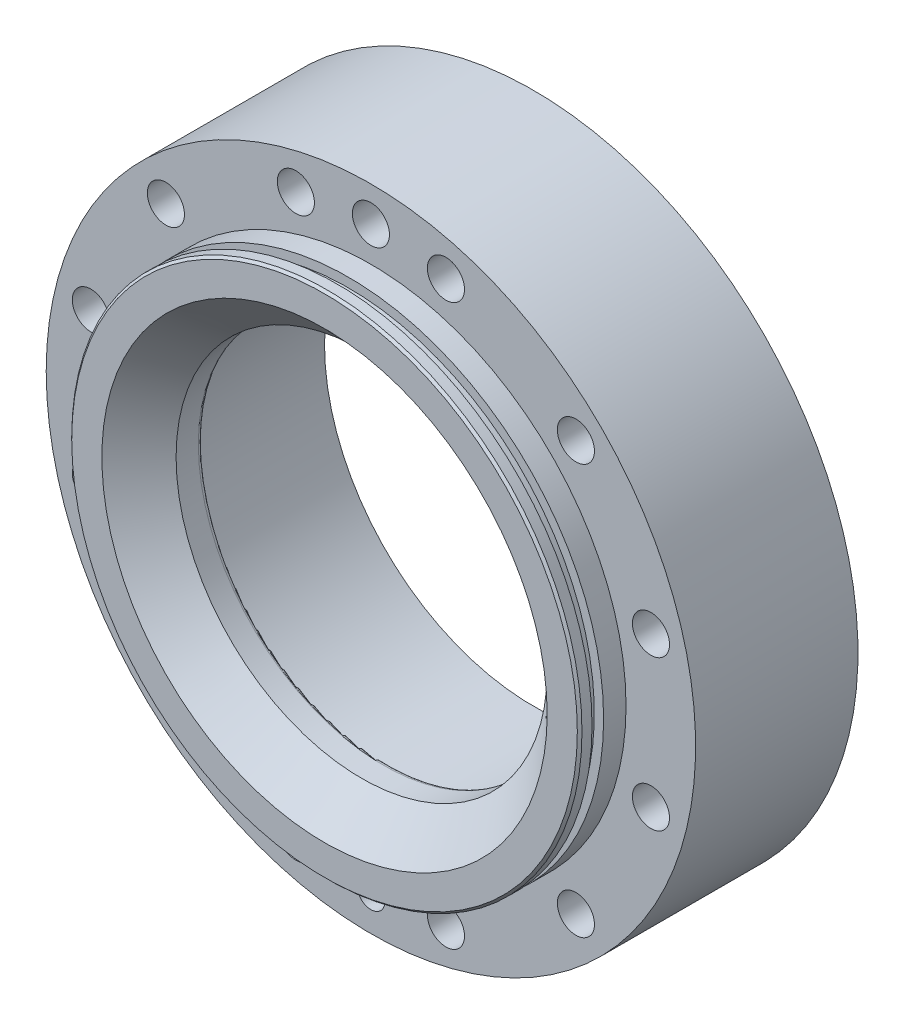
from build123d import *

# Parameters (mm, degrees)
SKETCH2_R             = 3
CUT_EXTRUDE1_DEPTH    = 9
SKETCH3_R             = 4
CUT_EXTRUDE2_DEPTH    = 10
SKETCH9_W             = 2
SKETCH9_H             = 2.5
CHAMFER1_SIZE         = 0.5
F_8_0MM_DOWEL_HOLE1_D = 8
FILLET2_R             = 1
CHAMFER2_SIZE         = 8


with BuildPart() as part:
    # Sketch1 → Revolve1 (revolve)
    with BuildSketch(Plane(origin=(0, 0, 0), x_dir=(1, 0, 0), z_dir=(0, 1, 0))):
        Polygon((-55, -19.79575879), (-55, -9.79575879), (-70, -9.79575879), (-70, 25.20424121), (-45, 25.20424121), (-45, -6), (-40, -6), (-40, -19.79575879), align=None)
    revolve(axis=Axis((0, 0, -52.707374268), (0, 0, 1)))

    # Sketch2 → Cut-Extrude1 (cut)
    with BuildSketch(Plane.XY.offset(9.79575879)):
        with Locations((0, -62.5)):
            Circle(SKETCH2_R)
    extrude(amount=-CUT_EXTRUDE1_DEPTH, mode=Mode.SUBTRACT)

    # Sketch3 → Cut-Extrude2 (cut)
    with BuildSketch(Plane.XY.offset(9.79575879)):
        with Locations((0, 62.5)):
            Circle(SKETCH3_R)
    extrude(amount=-CUT_EXTRUDE2_DEPTH, mode=Mode.SUBTRACT)

    # Sketch9 → Oring groove (revolve, cut)
    with BuildSketch(Plane(origin=(0, 0, 0), x_dir=(1, 0, 0), z_dir=(0, 1, 0))):
        with Locations((-54, -15.877787378)):
            Rectangle(SKETCH9_W, SKETCH9_H)
    revolve(axis=Axis((0, 0, -11.30771881), (0, 0, 1)), mode=Mode.SUBTRACT)

    # Chamfer1
    chamfer1_edges = [part.edges().sort_by_distance(p)[0] for p in [
        (55, 0, 19.79575879),
    ]]
    chamfer(chamfer1_edges, length=CHAMFER1_SIZE)

    # Ø8.0mm Dowel Hole1 (through all)
    with Locations(Plane.XY.offset(9.79575879)):
        with Locations((-60.370364143, 16.176190319), (-44.194173824, 44.194173824), (-16.176190319, 60.370364143), (16.176190319, 60.370364143), (44.194173824, 44.194173824), (60.370364143, 16.176190319), (60.370364143, -16.176190319), (44.194173824, -44.194173824), (16.176190319, -60.370364143), (-16.176190319, -60.370364143), (-44.194173824, -44.194173824), (-60.370364143, -16.176190319), (0, 0)):
            Hole(F_8_0MM_DOWEL_HOLE1_D / 2)

    # Fillet2
    fillet2_edges = [part.edges().sort_by_distance(p)[0] for p in [
        (40, 0, 6),
    ]]
    fillet(fillet2_edges, radius=FILLET2_R)

    # Chamfer2
    chamfer2_edges = [part.edges().sort_by_distance(p)[0] for p in [
        (40, 0, 19.79575879),
    ]]
    chamfer(chamfer2_edges, length=CHAMFER2_SIZE)


solid = part.part
